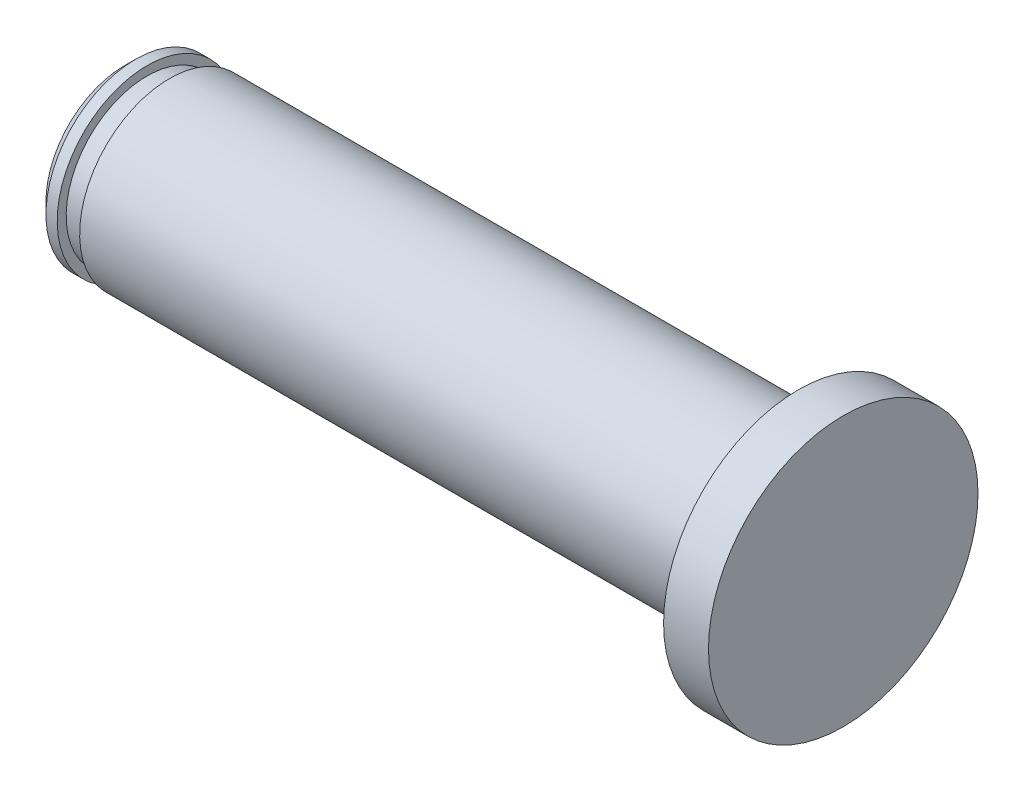
from build123d import *

# Parameters (mm, degrees)
CHAMFER_1_SIZE = 0.5


with BuildPart() as part:
    # Эскиз1 → Повернуть1 (revolve)
    with BuildSketch(Plane.XY):
        Polygon((0, 0), (-32, 0), (-32, 4), (-31, 4), (-31, 3.6), (-30, 3.6), (-30, 4), (-2, 4), (-2, 6), (0, 6), align=None)
    revolve(axis=Axis((-32, 0, 0), (1, 0, 0)))

    # Фаска1
    chamfer_1_edges = [part.edges().sort_by_distance(p)[0] for p in [
        (-32, -4, 0),
    ]]
    chamfer(chamfer_1_edges, length=CHAMFER_1_SIZE)


solid = part.part
